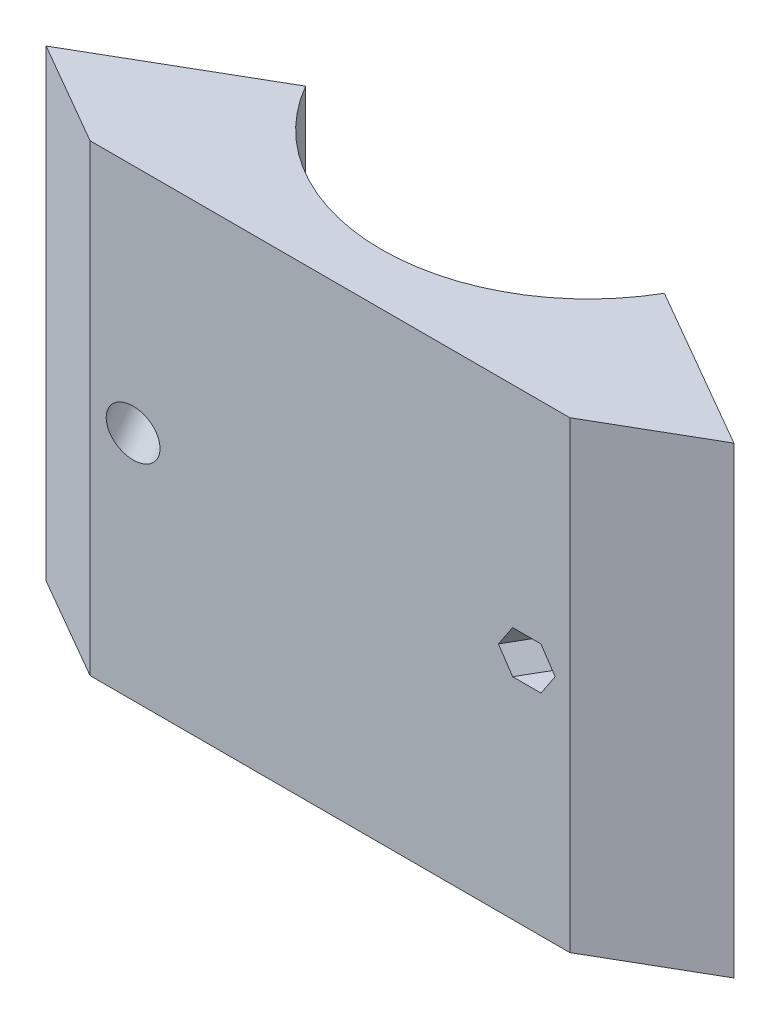
from build123d import *

# Parameters (mm, degrees)
BOSS_EXTRUDE1_DEPTH = 57.15
CUT_EXTRUDE1_START  = -10.000000066
SKETCH3_R           = 3.499999985
CUT_EXTRUDE1_DEPTH  = 111.56818241


with BuildPart() as part:
    # Sketch1 → Boss-Extrude1 (new, symmetric)
    with BuildSketch(Plane(origin=(0, 0, 0), x_dir=(1, 0, 0), z_dir=(0, 1, 0))):
        with BuildLine():
            Line((-44.258055055, -25.5524), (-84.849935901, -48.988133333))
            Line((-84.849935901, -48.988133333), (-59.186716436, -63.8048))
            Line((-59.186716436, -63.8048), (59.186716436, -63.8048))
            Line((59.186716436, -63.8048), (84.849935901, -48.988133333))
            Line((84.849935901, -48.988133333), (44.258055055, -25.5524))
            ThreePointArc((44.258055055, -25.5524), (0, -51.1048), (-44.258055055, -25.5524))
        make_face()
    extrude(amount=BOSS_EXTRUDE1_DEPTH, both=True)

    # Sketch2 → Cut-Revolve7 (revolve, cut)
    with BuildSketch(Plane(origin=(0, 0, 0), x_dir=(1, 0, 0), z_dir=(0, 1, 0))):
        Polygon((-43.878504985, -64.929800036), (-61.024306886, -35.232400008), (-64.055395786, -36.9824), (-46.909593885, -66.679800029), align=None)
    cut_revolve7 = revolve(axis=Axis((-64.055395786, 0, 36.9824), (0.4999999999999998, 0, 0.8660254037844388)), mode=Mode.SUBTRACT)

    # Sketch2<7> → Cut-Revolve8 (revolve, cut)
    with BuildSketch(Plane(origin=(0, 0, 0), x_dir=(1, 0, 0), z_dir=(0, 1, 0))):
        Polygon((-44.528024059, -63.8048), (-41.929947764, -63.8048), (-54.075749632, -42.767654067), (-56.024306853, -43.892654103), align=None)
    revolve(axis=Axis((-64.055395786, 0, 36.9824), (0.4999999999999998, 0, 0.8660254037844388)), mode=Mode.SUBTRACT)

    # Mirror1: Cut-Revolve7 across plane
    add(cut_revolve7.mirror(Plane(origin=(0, 0, 0), x_dir=(0, 0, 1), z_dir=(1, 0, 0))), mode=Mode.SUBTRACT)

    # Sketch3 → Cut-Extrude1 (cut, through all)
    with BuildSketch(Plane(origin=(0, 0, 0), x_dir=(-0.8660254037844386, 0, -0.5000000000000001), z_dir=(0.5000000000000001, 0, -0.8660254037844386)).offset(CUT_EXTRUDE1_START)):
        Polygon((-76.995888937, 5.250000041), (-80.026977874, 0), (-76.995888937, -5.250000041), (-70.933711063, -5.250000041), (-67.902622126, 0), (-70.933711063, 5.250000041), align=None)
        with Locations((-73.9648, 0)):
            Circle(SKETCH3_R, mode=Mode.SUBTRACT)
    extrude(amount=-CUT_EXTRUDE1_DEPTH, mode=Mode.SUBTRACT)


solid = part.part
